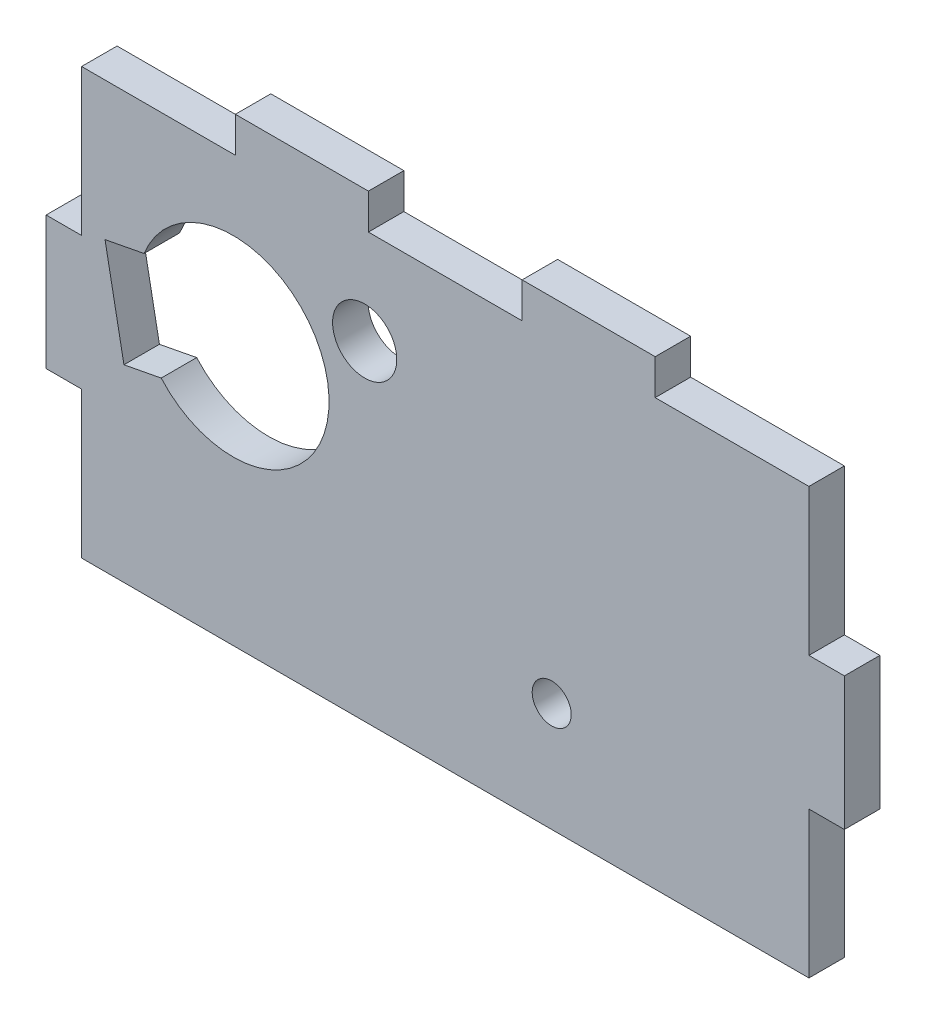
from build123d import *

# Parameters (mm, degrees)
BOSS_EXTRUDE1_DEPTH = 5.08
CAVITY2_OUTLINE_R   = 4.59774385
CAVITY2_OUTLINE_R_2 = 13.7414
CAVITY2_DEPTH       = 4.3688
CAVITY2_START       = 3.2512
CAVITY2_2_DEPTH     = 1.1176
CAVITY2_3_OUTLINE_R = 2.794
CAVITY2_3_DEPTH     = 0.7112
SKETCH10_R          = 4.59774385
SKETCH10_R_2        = 2.794
CUT_EXTRUDE1_DEPTH  = 5.08


# Read off the part's stored shape, not the designer's step: Cavity2
with BuildPart() as part:
    # Sketch1 → Boss-Extrude1 (new body)
    with BuildSketch(Plane.XY):
        Polygon((-94.341860078, 47.544254219), (-72.328526744, 47.544254219), (-72.328526744, 52.624254219), (-53.278526744, 52.624254219), (-53.278526744, 47.544254219), (-31.265193411, 47.544254219), (-31.265193411, 52.624254219), (-12.215193411, 52.624254219), (-12.215193411, 47.544254219), (9.798139922, 47.544254219), (9.798139922, 26.589254219), (14.878139922, 26.589254219), (14.878139922, 7.539254219), (9.798139922, 7.539254219), (9.798139922, -13.415745781), (-94.341860078, -13.415745781), (-94.341860078, 7.539254219), (-99.421860078, 7.539254219), (-99.421860078, 26.589254219), (-94.341860078, 26.589254219), align=None)
    extrude(amount=BOSS_EXTRUDE1_DEPTH)

    # Cavity2 outline → Cavity2 (cut)
    with BuildSketch(Plane.XY):
        with Locations((-53.811820296, 33.77125273)):
            Circle(CAVITY2_OUTLINE_R)
        with Locations((-72.649126193, 23.706396)):
            Circle(CAVITY2_OUTLINE_R_2)
    extrude(amount=CAVITY2_DEPTH, mode=Mode.SUBTRACT)

    # Cavity2 2 outline → Cavity2 2 (cut)
    with BuildSketch(Plane.XY.offset(CAVITY2_START)):
        with BuildLine():
            Line((-85.401408895, 28.825513097), (-90.989734661, 27.7567927))
            Line((-90.989734661, 27.7567927), (-88.279765083, 13.586395221))
            Line((-88.279765083, 13.586395221), (-82.945631867, 14.606503426))
            ThreePointArc((-82.945631867, 14.606503426), (-86.190053798, 21.367731092), (-85.401408895, 28.825513097))
        make_face()
    extrude(amount=CAVITY2_2_DEPTH, mode=Mode.SUBTRACT)

    # Cavity2 3 outline → Cavity2 3 (cut)
    with BuildSketch(Plane.XY):
        with Locations((-27.031860078, 2.217954219)):
            Circle(CAVITY2_3_OUTLINE_R)
    extrude(amount=CAVITY2_3_DEPTH, mode=Mode.SUBTRACT)

    # Sketch10 → Cut-Extrude1 (cut)
    with BuildSketch(Plane(origin=(0, 0, 0), x_dir=(-1, 0, 0), z_dir=(0, 0, -1))):
        with Locations((53.811820296, 33.77125273)):
            Circle(SKETCH10_R)
        with Locations((27.031860078, 2.217954219)):
            Circle(SKETCH10_R_2)
        with BuildLine():
            Line((82.945631867, 14.606503426), (88.279765083, 13.586395221))
            Line((88.279765083, 13.586395221), (90.989734661, 27.7567927))
            Line((90.989734661, 27.7567927), (85.401408894, 28.825513097))
            ThreePointArc((85.401408894, 28.825513097), (59.108198587, 26.045060907), (82.945631867, 14.606503426))
        make_face()
    extrude(amount=-CUT_EXTRUDE1_DEPTH, mode=Mode.SUBTRACT)


solid = part.part
